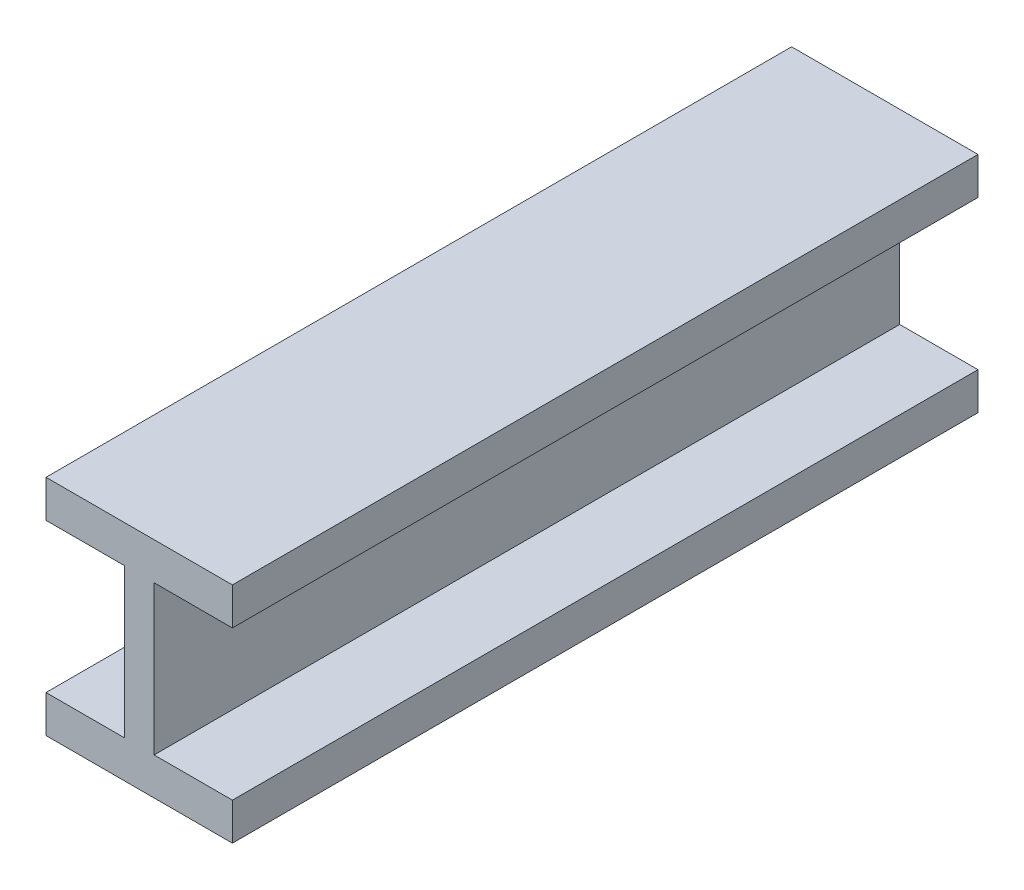
from build123d import *

# Parameters (mm, degrees)
BOSS_EXTRUDE1_DEPTH = 100


with BuildPart() as part:
    # Sketch1 → Boss-Extrude1 (new body)
    with BuildSketch(Plane.XY):
        Polygon((-12.5, -10), (-12.5, -15), (12.5, -15), (12.5, -10), (2, -10), (2, 10), (12.5, 10), (12.5, 15), (-12.5, 15), (-12.5, 10), (-2, 10), (-2, -10), align=None)
    extrude(amount=-BOSS_EXTRUDE1_DEPTH)


solid = part.part
